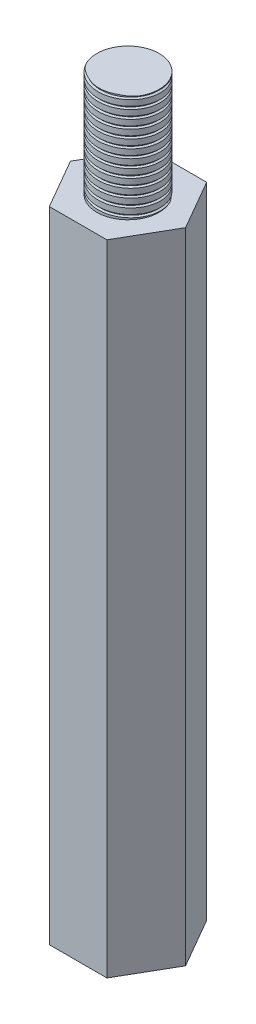
from build123d import *

# Parameters (mm, degrees)
SKETCH_1_R          = 1.46
EXTRUDE_1_DEPTH     = 30
SKETCH_1_3_R        = 1.46
CUT_EXTRUDE_1_DEPTH = 5
SKETCH_2_R          = 1.46
EXTRUDE_2_DEPTH     = 5
SWEEP_1_PITCH       = 0.4
SWEEP_1_FROM        = -0.1
SWEEP_2_PITCH       = 0.4


with BuildPart() as part:
    # 草图1 → 凸台-拉伸1 (new body)
    # profile 1 of 2: a face of its own
    with BuildSketch(Plane(origin=(0, 0, 0), x_dir=(1, 0, 0), z_dir=(0, 1, 0))):
        Polygon((-2.70199926, 0), (-1.35099963, -2.34), (1.35099963, -2.34), (2.70199926, 0), (1.35099963, 2.34), (-1.35099963, 2.34), align=None)
        Circle(SKETCH_1_R, mode=Mode.SUBTRACT)
    # profile 2 of 2: a face of its own
    with BuildSketch(Plane(origin=(0, 0, 0), x_dir=(1, 0, 0), z_dir=(0, 1, 0))):
        Circle(SKETCH_1_R)
    extrude(amount=EXTRUDE_1_DEPTH)

    # 草图1<3> → 切除-拉伸1 (cut)
    with BuildSketch(Plane(origin=(0, 0, 0), x_dir=(1, 0, 0), z_dir=(0, 1, 0))):
        with Locations(Location((0, 0, 0), (0, 0, 270))):
            Circle(SKETCH_1_3_R)
    extrude(amount=CUT_EXTRUDE_1_DEPTH, mode=Mode.SUBTRACT)

    # 切除-扫描2: arcs per turn and ends read off the stored shape
    # 切除-扫描2: the profile of 草图7 profile screwed along a right-hand helix through 23.75 turns, 6 arcs to a turn; built about Z, then put on its axis
    sweep_2_z = Axis((0, 0, 0), (0, 0, 1))
    sweep_2_corners = [(1.4597, 0, 0.1001), (1.66, 0, 0.033333333), (1.66, 0, -0.033333333), (1.4597, 0, -0.1001)]
    with BuildLine(mode=Mode.PRIVATE) as sweep_2_profile:
        Line(sweep_2_corners[0], sweep_2_corners[1])
        Line(sweep_2_corners[1], sweep_2_corners[2])
        Line(sweep_2_corners[2], sweep_2_corners[3])
        Line(sweep_2_corners[3], sweep_2_corners[0])
    sweep_2_cap = Face(sweep_2_profile.wire())
    sweep_2_turn_angles = [0, 30, 60, 90, 120, 150, 180, 210, 240, 270, 300, 330, 360]
    sweep_2_turn_weights = [1, 0.8660254037844387, 1, 0.8660254037844387, 1, 0.8660254037844387, 1, 0.8660254037844387, 1, 0.8660254037844387, 1, 0.8660254037844387, 1]
    sweep_2_turn_rails = [Edge.make_bspline([Vector(p[0], p[1], 0).rotate(sweep_2_z, sweep_2_turn_angles[k]) / sweep_2_turn_weights[k] + Vector(0, 0, p[2] + SWEEP_2_PITCH * sweep_2_turn_angles[k] / 360) for k in range(13)], [0, 0, 0, 1, 1, 2, 2, 3, 3, 4, 4, 5, 5, 6, 6, 6], 2, sweep_2_turn_weights) for p in sweep_2_corners]
    sweep_2_turn_sides = [Face.make_surface_from_curves(sweep_2_turn_rails[p[0]], sweep_2_turn_rails[p[1]]) for p in [(0, 1), (1, 2), (2, 3), (3, 0)]]
    sweep_2_last_angles = [8280, 8310, 8340, 8370, 8400, 8430, 8460, 8490, 8520, 8535, 8550]
    sweep_2_last_weights = [1, 0.8660254037844387, 1, 0.8660254037844387, 1, 0.8660254037844387, 1, 0.8660254037844387, 1, 0.965925826289056, 1]
    sweep_2_last_rails = [Edge.make_bspline([Vector(p[0], p[1], 0).rotate(sweep_2_z, sweep_2_last_angles[k]) / sweep_2_last_weights[k] + Vector(0, 0, p[2] + SWEEP_2_PITCH * sweep_2_last_angles[k] / 360) for k in range(11)], [0, 0, 0, 1, 1, 2, 2, 3, 3, 4, 4, 5, 5, 5], 2, sweep_2_last_weights) for p in sweep_2_corners]
    sweep_2_last_sides = [Face.make_surface_from_curves(sweep_2_last_rails[p[0]], sweep_2_last_rails[p[1]]) for p in [(0, 1), (1, 2), (2, 3), (3, 0)]]
    sweep_2 = Plane(origin=(0, 0, 0), x_dir=(0, 0, -1), z_dir=(0, 1, 0)) * Solid(Shell([*[p.moved(Location((0, 0, SWEEP_2_PITCH * i))) for i in range(23) for p in sweep_2_turn_sides], *sweep_2_last_sides, sweep_2_cap, sweep_2_cap.rotate(sweep_2_z, 8550).moved(Location((0, 0, SWEEP_2_PITCH * 8550 / 360)))]))
    add(sweep_2, mode=Mode.SUBTRACT)


with BuildPart() as body_2:
    # 草图2 → 凸台-拉伸2 (new body)
    with BuildSketch(Plane(origin=(0, 30, 0), x_dir=(1, 0, 0), z_dir=(0, 1, 0))):
        with Locations(Location((0, 0, 0), (0, 0, 270))):
            Circle(SKETCH_2_R)
    extrude(amount=EXTRUDE_2_DEPTH)

    # 切除-扫描1: arcs per turn and ends read off the stored shape
    # 切除-扫描1: the profile of 草图4 screwed along a left-hand helix through 18.75 turns, 6 arcs to a turn; built about Z, then put on its axis
    sweep_1_z = Axis((0, 0, 0), (0, 0, 1))
    sweep_1_corners = [(1.56, 5.45e-07, -0.400000022), (1.56, 5.45e-07, -0.200000022), (1.36, 4.75e-07, -0.266666689), (1.36, 4.75e-07, -0.333333356)]
    with BuildLine(mode=Mode.PRIVATE) as sweep_1_profile:
        Line(sweep_1_corners[0], sweep_1_corners[1])
        Line(sweep_1_corners[1], sweep_1_corners[2])
        Line(sweep_1_corners[2], sweep_1_corners[3])
        Line(sweep_1_corners[3], sweep_1_corners[0])
    sweep_1_cap = Face(sweep_1_profile.wire())
    sweep_1_turn_angles = [0, -30, -60, -90, -120, -150, -180, -210, -240, -270, -300, -330, -360]
    sweep_1_turn_weights = [1, 0.8660254037844387, 1, 0.8660254037844387, 1, 0.8660254037844387, 1, 0.8660254037844387, 1, 0.8660254037844387, 1, 0.8660254037844387, 1]
    sweep_1_turn_rails = [Edge.make_bspline([Vector(p[0], p[1], 0).rotate(sweep_1_z, sweep_1_turn_angles[k]) / sweep_1_turn_weights[k] + Vector(0, 0, p[2] + -SWEEP_1_PITCH * sweep_1_turn_angles[k] / 360) for k in range(13)], [0, 0, 0, 1, 1, 2, 2, 3, 3, 4, 4, 5, 5, 6, 6, 6], 2, sweep_1_turn_weights) for p in sweep_1_corners]
    sweep_1_turn_sides = [Face.make_surface_from_curves(sweep_1_turn_rails[p[0]], sweep_1_turn_rails[p[1]]) for p in [(0, 1), (1, 2), (2, 3), (3, 0)]]
    sweep_1_last_angles = [-6480, -6510, -6540, -6570, -6600, -6630, -6660, -6690, -6720, -6735, -6750]
    sweep_1_last_weights = [1, 0.8660254037844387, 1, 0.8660254037844387, 1, 0.8660254037844387, 1, 0.8660254037844387, 1, 0.9659258262889348, 1]
    sweep_1_last_rails = [Edge.make_bspline([Vector(p[0], p[1], 0).rotate(sweep_1_z, sweep_1_last_angles[k]) / sweep_1_last_weights[k] + Vector(0, 0, p[2] + -SWEEP_1_PITCH * sweep_1_last_angles[k] / 360) for k in range(11)], [0, 0, 0, 1, 1, 2, 2, 3, 3, 4, 4, 5, 5, 5], 2, sweep_1_last_weights) for p in sweep_1_corners]
    sweep_1_last_sides = [Face.make_surface_from_curves(sweep_1_last_rails[p[0]], sweep_1_last_rails[p[1]]) for p in [(0, 1), (1, 2), (2, 3), (3, 0)]]
    sweep_1 = Plane(origin=(0, 30.1, 0), x_dir=(0, 0, 1), z_dir=(0, 1, 0)) * split(Solid(Shell([*[p.moved(Location((0, 0, SWEEP_1_PITCH * i))) for i in range(18) for p in sweep_1_turn_sides], *sweep_1_last_sides, sweep_1_cap, sweep_1_cap.rotate(sweep_1_z, -6750).moved(Location((0, 0, -SWEEP_1_PITCH * -6750 / 360)))])), bisect_by=Plane.XY.offset(SWEEP_1_FROM), keep=Keep.TOP, mode=Mode.PRIVATE)
    add(sweep_1, mode=Mode.SUBTRACT)


solid = Compound([part.part, body_2.part])
